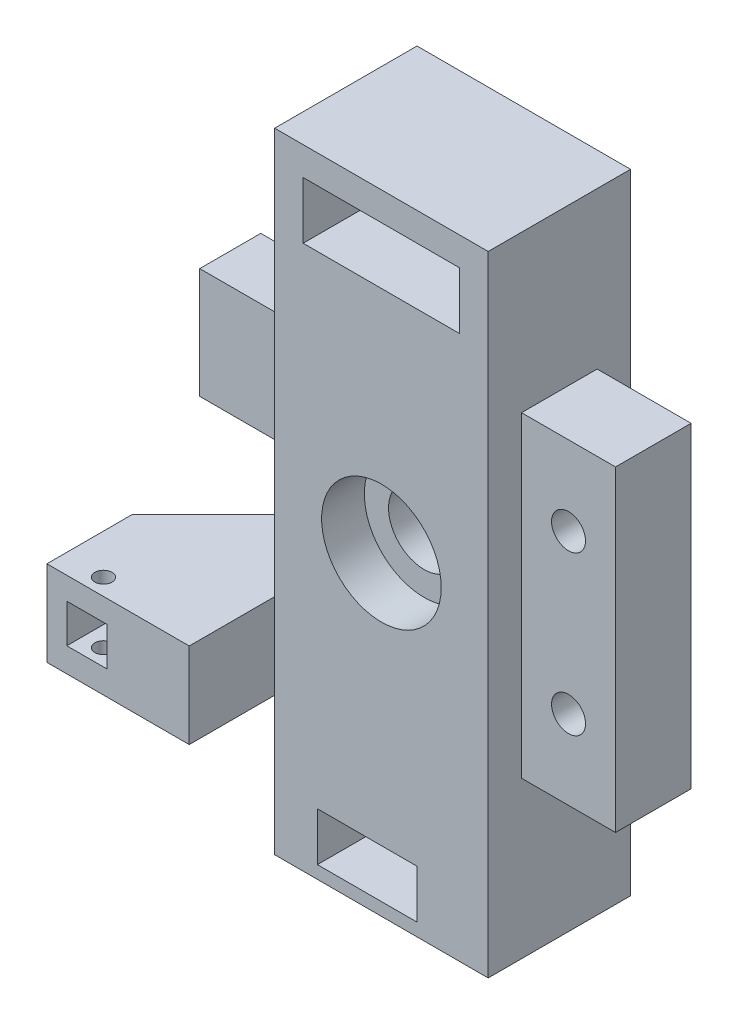
from build123d import *

# Parameters (mm, degrees)
SKETCH1_W                         = 75
SKETCH1_H                         = 50
BE_MAIN_UPRIGHT_BODY_DEPTH        = 221
SKETCH4_R                         = 12.5
CE_THROUGH_HOLE_DEPTH             = 230.667694724
SKETCH2_R                         = 21
CE_INNER_BEARING_DEPTH            = 15
SKETCH3_R                         = 23.5
CE_OUTER_BEARING_DEPTH            = 15
SKETCH7_W                         = 26.55070312
SKETCH7_H                         = 111.194580496
BE_CALIPER_MOUNT_DEPTH            = 33
SKETCH8_W                         = 21.441072272
SKETCH8_H                         = 38.879019901
BE_TEMP_SENSOR_MOUNT_DEPTH        = 33
SKETCH9_W                         = 60
SKETCH9_H                         = 30
BE_TIE_ROD_MOUNT_DEPTH            = 50
SKETCH10_R                        = 5.968024458
CE_CALIPER_HOLES_DEPTH            = 242.325913005
SKETCH12_R                        = 4
CE_TOP_CLEVIS_HOLES_DEPTH         = 243.893495178
SKETCH13_W                        = 55
SKETCH13_H                        = 20
CE_TOP_CLEVIS_SPACE_DEPTH         = 35
SKETCH14_W                        = 25
SKETCH14_H                        = 12
CE_BOTTOM_CLEVIS_SPACE_DEPTH      = 243.893495178
SKETCH15_W                        = 25
SKETCH15_H                        = 5
CE_EXPAND_BOTTOM_CLEVIS_DEPTH     = 243.893495178
CE_WIDEN_BOTTOM_CLEVIS_DEPTH      = 240.74121548
CE_WIDEN_BOTTOM_CLEVIS_DEPTH_BACK = 240.74121548
SKETCH16_W                        = 10.007554032
SKETCH16_H                        = 17
CHAMFER1_SIZE                     = 30
SKETCH18_W                        = 14.04398123
SKETCH18_H                        = 13.562779604
CUT_EXTRUDE1_DEPTH                = 20
SKETCH19_R                        = 3
CUT_EXTRUDE2_DEPTH                = 177.032667423


with BuildPart() as part:
    # Sketch1 → BE - main upright body (new body)
    with BuildSketch(Plane(origin=(0, 0, 0), x_dir=(1, 0, 0), z_dir=(0, 1, 0))):
        Rectangle(SKETCH1_W, SKETCH1_H)
    extrude(amount=BE_MAIN_UPRIGHT_BODY_DEPTH)

    # Sketch4 → CE - Through hole (cut, through all)
    with BuildSketch(Plane.XY.offset(25)):
        with Locations((0, 110.5)):
            Circle(SKETCH4_R)
    extrude(amount=-CE_THROUGH_HOLE_DEPTH, mode=Mode.SUBTRACT)

    # Sketch2 → CE - Inner bearing (cut)
    with BuildSketch(Plane.XY.offset(25)):
        with Locations((0, 110.5)):
            Circle(SKETCH2_R)
    extrude(amount=-CE_INNER_BEARING_DEPTH, mode=Mode.SUBTRACT)

    # Sketch3 → CE - Outer bearing (cut)
    with BuildSketch(Plane(origin=(0, 0, -25), x_dir=(-1, 0, 0), z_dir=(0, 0, -1))):
        with Locations((0, 110.5)):
            Circle(SKETCH3_R)
    extrude(amount=-CE_OUTER_BEARING_DEPTH, mode=Mode.SUBTRACT)

    # Sketch7 → BE - caliper mount (add)
    with BuildSketch(Plane(origin=(37.5, 0, 0), x_dir=(0, 0, -1), z_dir=(1, 0, 0))):
        with Locations((0, 110.5)):
            Rectangle(SKETCH7_W, SKETCH7_H)
    extrude(amount=BE_CALIPER_MOUNT_DEPTH)

    # Sketch8 → BE - temp sensor mount (add)
    with BuildSketch(Plane.ZY.offset(37.5)):
        with Locations((7.597144772, 139.012739273)):
            Rectangle(SKETCH8_W, SKETCH8_H)
    extrude(amount=BE_TEMP_SENSOR_MOUNT_DEPTH)

    # Sketch9 → BE - tie rod mount (add)
    with BuildSketch(Plane.ZY.offset(37.5)):
        with Locations((25, 63.5)):
            Rectangle(SKETCH9_W, SKETCH9_H)
    extrude(amount=BE_TIE_ROD_MOUNT_DEPTH)

    # Sketch10 → CE - caliper holes (cut, through all)
    with BuildSketch(Plane.XY.offset(13.27535156)):
        with Locations((54, 138.298645124)):
            Circle(SKETCH10_R)
        with Locations((54, 82.701354876)):
            Circle(SKETCH10_R)
    extrude(amount=-CE_CALIPER_HOLES_DEPTH, mode=Mode.SUBTRACT)

    # Sketch12 → CE - top clevis holes (cut, through all)
    with BuildSketch(Plane.XY.offset(25)):
        with Locations((-12.5, 201)):
            Circle(SKETCH12_R)
        with Locations((12.5, 201)):
            Circle(SKETCH12_R)
    extrude(amount=-CE_TOP_CLEVIS_HOLES_DEPTH, mode=Mode.SUBTRACT)

    # Sketch13 → CE - top clevis space (cut)
    with BuildSketch(Plane.XY.offset(25)):
        with Locations((0, 201)):
            Rectangle(SKETCH13_W, SKETCH13_H)
    extrude(amount=-CE_TOP_CLEVIS_SPACE_DEPTH, mode=Mode.SUBTRACT)

    # Sketch14 → CE - bottom clevis space (cut, through all)
    with BuildSketch(Plane.XY.offset(25)):
        with Locations((-9.98, 10.5)):
            Rectangle(SKETCH14_W, SKETCH14_H)
    extrude(amount=-CE_BOTTOM_CLEVIS_SPACE_DEPTH, mode=Mode.SUBTRACT)

    # Sketch15 → CE - expand bottom clevis (cut, through all)
    with BuildSketch(Plane.XY.offset(25)):
        with Locations((-9.98, 19)):
            Rectangle(SKETCH15_W, SKETCH15_H)
    extrude(amount=-CE_EXPAND_BOTTOM_CLEVIS_DEPTH, mode=Mode.SUBTRACT)

    # Sketch16 → CE - widen bottom clevis (cut, two sides: drawn at the far end of the back side and taken through both)
    with BuildSketch(Plane(origin=(2.52, 4.5, 25), x_dir=(1, 0, 0), z_dir=(0, 0, 1)).offset(-CE_WIDEN_BOTTOM_CLEVIS_DEPTH_BACK)):
        with Locations((5.003777016, 8.5)):
            Rectangle(SKETCH16_W, SKETCH16_H)
    extrude(amount=CE_WIDEN_BOTTOM_CLEVIS_DEPTH + CE_WIDEN_BOTTOM_CLEVIS_DEPTH_BACK, mode=Mode.SUBTRACT)

    # Chamfer1
    chamfer1_edges = [part.edges().sort_by_distance(p)[0] for p in [
        (-87.5, 63.5, -5),
    ]]
    chamfer(chamfer1_edges, length=CHAMFER1_SIZE)

    # Sketch18 → Cut-Extrude1 (cut)
    with BuildSketch(Plane.XY.offset(55)):
        with Locations((-73.48, 63.84)):
            Rectangle(SKETCH18_W, SKETCH18_H)
    extrude(amount=-CUT_EXTRUDE1_DEPTH, mode=Mode.SUBTRACT)

    # Sketch19 → Cut-Extrude2 (cut, through all)
    with BuildSketch(Plane(origin=(0, 78.5, 0), x_dir=(1, 0, 0), z_dir=(0, 1, 0))):
        with Locations((-73.48, -49.15)):
            Circle(SKETCH19_R)
    extrude(amount=-CUT_EXTRUDE2_DEPTH, mode=Mode.SUBTRACT)


solid = part.part
